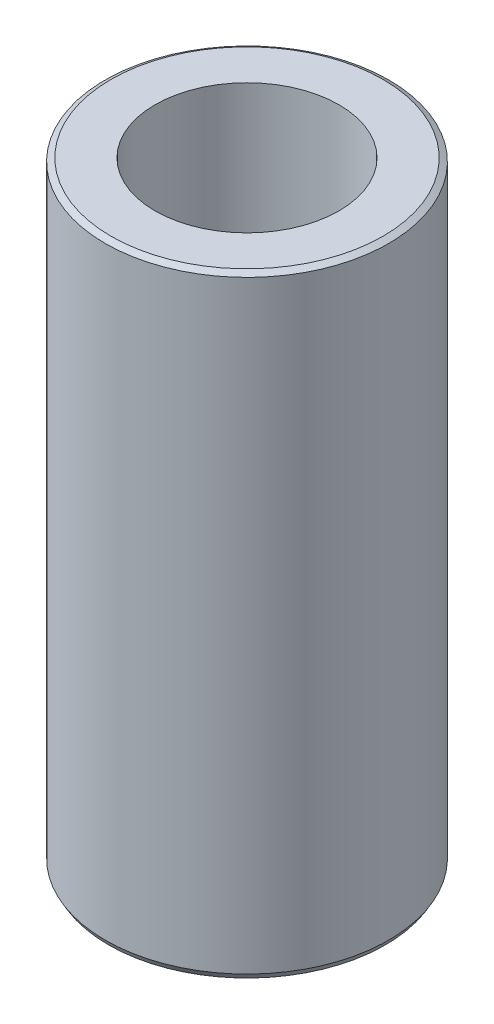
from build123d import *
from OCP.BRepFilletAPI import BRepFilletAPI_MakeChamfer

# Parameters (mm, degrees)
SKETCH1_R           = 50
BOSS_EXTRUDE1_DEPTH = 216.085897486
SKETCH2_R           = 32.446798317
CUT_EXTRUDE1_DEPTH  = 228.361199619
CHAMFER1_SIZE       = 1.182147875
CHAMFER1_SIZE2      = 2.047540182


with BuildPart() as part:
    # Sketch1 → Boss-Extrude1 (new body)
    with BuildSketch(Plane(origin=(0, 0, 0), x_dir=(1, 0, 0), z_dir=(0, 1, 0))):
        Circle(SKETCH1_R)
    extrude(amount=BOSS_EXTRUDE1_DEPTH)

    # Sketch2 → Cut-Extrude1 (cut, through all)
    with BuildSketch(Plane(origin=(0, 0, 0), x_dir=(1, 0, 0), z_dir=(0, 1, 0))):
        Circle(SKETCH2_R)
    extrude(amount=CUT_EXTRUDE1_DEPTH, mode=Mode.SUBTRACT)

    # Chamfer1: one chamfer whose edges measure the first distance from different faces: ONE call of the kernel's chamfer builder (chamfer() names one face for all edges)
    chamfer1_edges_1 = [part.edges().sort_by_distance(p)[0] for p in [
        (-50, 216.085897486, 0),
    ]]
    chamfer1_side_1 = [part.faces().sort_by_distance(p)[0] for p in [
        (-50, 108.042948743, 0),
    ]]
    chamfer1_edges_2 = [part.edges().sort_by_distance(p)[0] for p in [
        (-50, 0, 0),
    ]]
    chamfer1_side_2 = [part.faces().sort_by_distance(p)[0] for p in [
        (-48.585786438, 0, 0),
    ]]
    chamfer1 = BRepFilletAPI_MakeChamfer(part.part.solid().wrapped)
    for e in chamfer1_edges_1:
        chamfer1.Add(CHAMFER1_SIZE, CHAMFER1_SIZE2, e.wrapped, chamfer1_side_1[0].wrapped)  # the first distance lies on this face
    for e in chamfer1_edges_2:
        chamfer1.Add(CHAMFER1_SIZE, CHAMFER1_SIZE2, e.wrapped, chamfer1_side_2[0].wrapped)  # the first distance lies on this face
    add(Compound.cast(chamfer1.Shape()), mode=Mode.REPLACE)


solid = part.part
